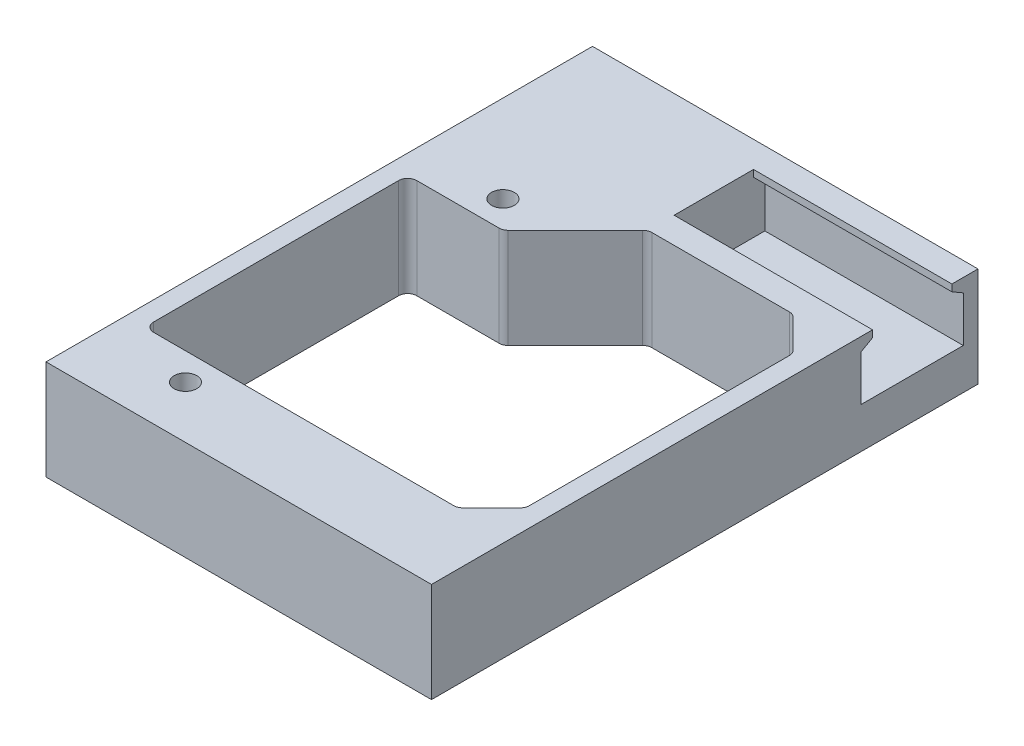
from build123d import *

# Parameters (mm, degrees)
BOSS_EXTRUDE1_START      = -1
SKETCH1_W                = 1.7
SKETCH1_H                = 89.2
BOSS_EXTRUDE1_DEPTH      = 8.8
SKETCH4_W                = 33.7
SKETCH4_H                = 11.6
BOSS_EXTRUDE3_DEPTH      = 8.8
SERVO_HOLDER_DEPTH       = 1
SERVO_HOLDER_DEPTH_BACK  = 8.8
SKETCH3_W                = 14
SKETCH3_H                = 7
SKETCH3_R                = 1
SKETCH37_W               = 20
SKETCH37_H               = 7
BOSS_EXTRUDE19_DEPTH     = 9.8
CUT_EXTRUDE10_DEPTH      = 93.434679639
CUT_EXTRUDE10_DEPTH_BACK = 93.434679639
SKETCH29_W               = 34.409909993
SKETCH29_H               = 6.377389624
BOSS_EXTRUDE13_START     = 2
SKETCH30_W               = 34
SKETCH30_H               = 38
SKETCH30_R               = 1.6
BOSS_EXTRUDE13_DEPTH     = 6.5
SKETCH41_W               = 17.288461538
SKETCH41_H               = 8.8
CUT_EXTRUDE14_DEPTH      = 15
BOSS_EXTRUDE14_START     = -38
SKETCH32_R               = 1.45
SKETCH32_R_2             = 5
BOSS_EXTRUDE14_DEPTH     = 8.8
BOSS_EXTRUDE16_DEPTH     = 3
BOSS_EXTRUDE17_DEPTH     = 3
BOSS_EXTRUDE18_DEPTH     = 8.8
SKETCH39_W               = 1.7
SKETCH39_H               = 41.2
BOSS_EXTRUDE20_DEPTH     = 8.8
CUT_EXTRUDE13_DEPTH      = 17.5
CHAMFER2_SIZE            = 0.6
CHAMFER2_SIZE_2          = 1.039230485
CHAMFER3_SIZE            = 3
FILLET10_R               = 6
CUT_EXTRUDE15_DEPTH      = 10
CHAMFER4_SIZE            = 2.5
CUT_EXTRUDE16_DEPTH      = 10
FILLET11_R               = 0.8
SKETCH44_W               = 59.192885725
SKETCH44_H               = 45.417181718
CUT_EXTRUDE17_DEPTH      = 87.948983376


with BuildPart() as part:
    # Sketch1 → Boss-Extrude1 (new body)
    with BuildSketch(Plane(origin=(0, 0, 0), x_dir=(1, 0, 0), z_dir=(0, 1, 0)).offset(BOSS_EXTRUDE1_START)):
        with Locations((-20.85, 25.311538462)):
            Rectangle(SKETCH1_W, SKETCH1_H)
    extrude(amount=-BOSS_EXTRUDE1_DEPTH)

    # Sketch4 → Boss-Extrude3 (add)
    with BuildSketch(Plane.XZ.offset(9.8)):
        with Locations((-4.85, -64.111538462)):
            Rectangle(SKETCH4_W, SKETCH4_H)
    extrude(amount=-BOSS_EXTRUDE3_DEPTH)

    # Sketch3 → Servo Holder (add, two sides: drawn at the far end of the back side and taken through both)
    # profile 1 of 2: a face of its own
    with BuildSketch(Plane.XZ.offset(9.8).offset(-SERVO_HOLDER_DEPTH_BACK)):
        with Locations((-14.7, -55.411538462)):
            Rectangle(SKETCH3_W, SKETCH3_H)
        with Locations(Location((-14, -54.311538462, 0), (0, 0, 270))):
            Circle(SKETCH3_R, mode=Mode.SUBTRACT)
    # profile 2 of 2: a face of its own
    with BuildSketch(Plane.XZ.offset(9.8).offset(-SERVO_HOLDER_DEPTH_BACK)):
        with Locations((-14.7, -25.211538462)):
            Rectangle(SKETCH3_W, SKETCH3_H)
        with Locations(Location((-14, -26.311538462, 0), (0, 0, 90))):
            Circle(SKETCH3_R, mode=Mode.SUBTRACT)
    extrude(amount=SERVO_HOLDER_DEPTH + SERVO_HOLDER_DEPTH_BACK)

    # Sketch37 → Boss-Extrude19 (add)
    with BuildSketch(Plane(origin=(0, -1, 0), x_dir=(1, 0, 0), z_dir=(0, 1, 0))):
        with Locations((2.3, 25.211538462)):
            Rectangle(SKETCH37_W, SKETCH37_H)
    extrude(amount=-BOSS_EXTRUDE19_DEPTH)

    # Sketch29 → Cut-Extrude10 (cut, two sides: drawn at the far end of the back side and taken through both)
    with BuildSketch(Plane(origin=(0, 0, -69.911538462), x_dir=(-1, 0, 0), z_dir=(0, 0, -1)).offset(-CUT_EXTRUDE10_DEPTH_BACK)):
        with Locations((4.495045004, -12.988694812)):
            Rectangle(SKETCH29_W, SKETCH29_H)
    extrude(amount=CUT_EXTRUDE10_DEPTH + CUT_EXTRUDE10_DEPTH_BACK, mode=Mode.SUBTRACT)


with BuildPart() as body_2:
    # Sketch30 → Boss-Extrude13 (new body)
    with BuildSketch(Plane.XY.offset(BOSS_EXTRUDE13_START)):
        with Locations((-4.7, -20)):
            Rectangle(SKETCH30_W, SKETCH30_H)
        with Locations(Location((5.3, -34, 0), (0, 0, 180))):
            Circle(SKETCH30_R, mode=Mode.SUBTRACT)
        with Locations(Location((5.3, -19, 0), (0, 0, 180))):
            Circle(SKETCH30_R, mode=Mode.SUBTRACT)
        with Locations(Location((-14.7, -34, 0), (0, 0, 180))):
            Circle(SKETCH30_R, mode=Mode.SUBTRACT)
        with Locations(Location((-14.7, -19, 0), (0, 0, 180))):
            Circle(SKETCH30_R, mode=Mode.SUBTRACT)
    extrude(amount=BOSS_EXTRUDE13_DEPTH)


with BuildPart() as cut_extrude14_tool:
    # Sketch41 → Cut-Extrude14 (new body)
    with BuildSketch(Plane(origin=(-20, 0, 0), x_dir=(0, 0, -1), z_dir=(1, 0, 0))):
        with Locations((-10.644230769, -5.4)):
            Rectangle(SKETCH41_W, SKETCH41_H)
    extrude(amount=-CUT_EXTRUDE14_DEPTH)


with BuildPart() as part_1:
    add(part.part)

    # Cut-Extrude14: cut by cut_extrude14_tool
    add(cut_extrude14_tool.part, mode=Mode.SUBTRACT)



with BuildPart() as body_2_1:
    add(body_2.part)

    # Cut-Extrude14: cut by cut_extrude14_tool
    add(cut_extrude14_tool.part, mode=Mode.SUBTRACT)

    # Sketch32 → Boss-Extrude14 (add)
    with BuildSketch(Plane.XZ.offset(39).offset(BOSS_EXTRUDE14_START)):
        with BuildLine():
            ThreePointArc((11.872921748, 2), (25.925390485, -3.535644523), (35.05, 8.5))
            ThreePointArc((35.05, 8.5), (22.55, 21), (10.05, 8.5))
            Line((10.05, 8.5), (12.3, 8.5))
            Line((12.3, 8.5), (12.3, 2))
            Line((12.3, 2), (11.872921748, 2))
        make_face()
        with Locations(Location((15.25884337, 2.409923235, 0), (0, 0, 180))):
            Circle(SKETCH32_R, mode=Mode.SUBTRACT)
        with Locations(Location((28.640076765, 1.20884337, 0), (0, 0, 180))):
            Circle(SKETCH32_R, mode=Mode.SUBTRACT)
        with Locations(Location((16.459923235, 15.79115663, 0), (0, 0, 180))):
            Circle(SKETCH32_R, mode=Mode.SUBTRACT)
        with Locations(Location((22.55, 8.5, 0), (0, 0, 180))):
            Circle(SKETCH32_R_2, mode=Mode.SUBTRACT)
        with Locations(Location((29.84115663, 14.590076765, 0), (0, 0, 180))):
            Circle(SKETCH32_R, mode=Mode.SUBTRACT)
    extrude(amount=BOSS_EXTRUDE14_DEPTH)


with BuildPart() as part_2:
    add(part_1.part)

    add(body_2_1.part)  # Boss-Extrude16 merges body 2
    # Sketch34 → Boss-Extrude16 (add)
    with BuildSketch(Plane.ZY.offset(21.7)):
        Polygon((-21.711538462, -1), (-21.711538462, -9.8), (2, -39), (8.5, -39), (8.5, -1), align=None)
    extrude(amount=-BOSS_EXTRUDE16_DEPTH)

    # Sketch35 → Boss-Extrude17 (add)
    with BuildSketch(Plane(origin=(12.3, 0, 0), x_dir=(0, 0, -1), z_dir=(1, 0, 0))):
        Polygon((-2, -1), (21.711538462, -1), (21.711538462, -9.8), (-2, -39), (-8.5, -39), (-8.5, -9.8), (-8.5, -1), align=None)
    extrude(amount=-BOSS_EXTRUDE17_DEPTH)

    # Sketch36 → Boss-Extrude18 (add)
    with BuildSketch(Plane.XZ.offset(9.8)):
        Polygon((12.3, -10.579162849), (16.63422252, -2.511520186), (12.3, 1.345455989), align=None)
    extrude(amount=-BOSS_EXTRUDE18_DEPTH)

    # Sketch39 → Boss-Extrude20 (add)
    with BuildSketch(Plane(origin=(0, -1, 0), x_dir=(1, 0, 0), z_dir=(0, 1, 0))):
        with Locations((11.45, 49.311538462)):
            Rectangle(SKETCH39_W, SKETCH39_H)
    extrude(amount=-BOSS_EXTRUDE20_DEPTH)

    # Sketch40 → Cut-Extrude13 (cut)
    with BuildSketch(Plane(origin=(12.3, 0, 0), x_dir=(0, 0, -1), z_dir=(1, 0, 0))):
        Polygon((64.111538462, -1), (60.611538462, -1), (60.611538462, -2.2), (59.611538462, -2.2), (59.611538462, -6.2), (64.111538462, -6.2), align=None)
        Polygon((67.611538462, -1), (64.111538462, -1), (64.111538462, -6.2), (68.611538462, -6.2), (68.611538462, -2.2), (67.611538462, -2.2), align=None)
    extrude(amount=-CUT_EXTRUDE13_DEPTH, mode=Mode.SUBTRACT)

    # Chamfer2
    # the kernel refuses this chamfer: 1.039230485, 0.6 mm, written as the material it takes off along each edge
    with BuildSketch(Plane(origin=(14.988578382, -2.2, -67.611538462), x_dir=(0, 0.9983227437537925, 0.05789386240267319), z_dir=(-1, 0, 0))) as chamfer2_piece_1_section:
        Polygon((CHAMFER2_SIZE * 0.998322743754, CHAMFER2_SIZE * 0.0578938624027), (-CHAMFER2_SIZE_2 * 0.0578938623771, CHAMFER2_SIZE_2 * 0.998322743313), (0, 0), align=None)
    chamfer2_piece_1 = extrude(amount=20.188578382, mode=Mode.PRIVATE)
    chamfer2_piece_1 = split(chamfer2_piece_1, bisect_by=Plane(origin=(4.894289191, -2.005782009, -68.611538462), z_dir=(0, 0, 1)), keep=Keep.TOP, mode=Mode.PRIVATE)
    add(chamfer2_piece_1, mode=Mode.SUBTRACT)
    with BuildSketch(Plane(origin=(14.988578382, -2.2, -60.611538462), x_dir=(0, 0.9983227437537925, -0.05789386240267317), z_dir=(-1, 0, 0))) as chamfer2_piece_2_section:
        Polygon((CHAMFER2_SIZE * 0.998322743754, -CHAMFER2_SIZE * 0.0578938624027), (-CHAMFER2_SIZE_2 * 0.0578938623771, -CHAMFER2_SIZE_2 * 0.998322743313), (0, 0), align=None)
    chamfer2_piece_2 = extrude(amount=20.188578382, mode=Mode.PRIVATE)
    chamfer2_piece_2 = split(chamfer2_piece_2, bisect_by=Plane(origin=(4.894289191, -2.005782009, -59.611538462), z_dir=(0, 0, -1)), keep=Keep.TOP, mode=Mode.PRIVATE)
    add(chamfer2_piece_2, mode=Mode.SUBTRACT)

    # Chamfer3
    chamfer3_edges = [part_2.edges().sort_by_distance(p)[0] for p in [
        (10.6, -5.4, -58.311538462),
        (10.6, -5.4, -28.711538462),
    ]]
    chamfer(chamfer3_edges, length=CHAMFER3_SIZE)

    # Fillet10
    fillet10_edges = [part_2.edges().sort_by_distance(p)[0] for p in [
        (16.63422252, -5.4, -2.511520186),
        (12.3, -5.4, -10.579162849),
    ]]
    fillet(fillet10_edges, radius=FILLET10_R)

    # Sketch42 → Cut-Extrude15 (cut)
    with BuildSketch(Plane.XY.offset(8.5)):
        with BuildLine():
            Line((-1.1, -1), (-1.1, -10.6))
            ThreePointArc((-1.1, -10.6), (-4.7, -14.2), (-8.3, -10.6))
            Line((-8.3, -10.6), (-8.3, -1))
            Line((-8.3, -1), (-1.1, -1))
        make_face()
    extrude(amount=-CUT_EXTRUDE15_DEPTH, mode=Mode.SUBTRACT)

    # Chamfer4
    chamfer4_edges = [part_2.edges().sort_by_distance(p)[0] for p in [
        (-7.7, -5.4, -58.311538462),
    ]]
    chamfer(chamfer4_edges, length=CHAMFER4_SIZE)

    # Sketch43 → Cut-Extrude16 (cut)
    with BuildSketch(Plane(origin=(0, -1, 0), x_dir=(1, 0, 0), z_dir=(0, 1, 0))):
        Polygon((-5.2, 58.311538462), (-11.6, 51.911538462), (-5.2, 51.911538462), align=None)
    extrude(amount=-CUT_EXTRUDE16_DEPTH, mode=Mode.SUBTRACT)

    # Fillet11
    fillet11_edges = [part_2.edges().sort_by_distance(p)[0] for p in [
        (-20, -5.4, -28.711538462),
        (-20, -5.4, -51.911538462),
        (10.6, -5.4, -55.311538462),
        (10.6, -5.4, -31.711538462),
        (7.6, -5.4, -28.711538462),
        (7.6, -5.4, -58.311538462),
        (-5.2, -5.4, -58.311538462),
        (-11.6, -5.4, -51.911538462),
    ]]
    fillet(fillet11_edges, radius=FILLET11_R)

    # Sketch44 → Cut-Extrude17 (cut, through all)
    with BuildSketch(Plane(origin=(0, -1, 0), x_dir=(1, 0, 0), z_dir=(0, 1, 0))):
        with Locations((7.896442862, -0.997052397)):
            Rectangle(SKETCH44_W, SKETCH44_H)
    extrude(amount=-CUT_EXTRUDE17_DEPTH, mode=Mode.SUBTRACT)


solid = part_2.part
